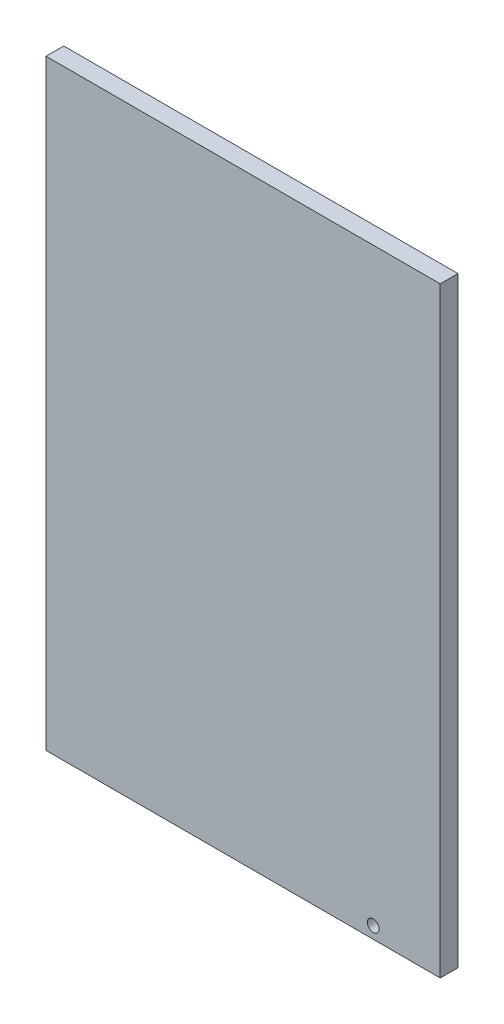
from build123d import *

# Parameters (mm, degrees)
SKETCH1_W           = 200
SKETCH1_H           = 305
BOSS_EXTRUDE1_DEPTH = 9
SKETCH2_R           = 3
CUT_EXTRUDE1_DEPTH  = 183.584911753


with BuildPart() as part:
    # Sketch1 → Boss-Extrude1 (new body)
    with BuildSketch(Plane.XY):
        Rectangle(SKETCH1_W, SKETCH1_H)
    extrude(amount=BOSS_EXTRUDE1_DEPTH)

    # Sketch2 → Cut-Extrude1 (cut, through all)
    with BuildSketch(Plane.XY.offset(9)):
        with Locations((66, -146.5)):
            Circle(SKETCH2_R)
    extrude(amount=-CUT_EXTRUDE1_DEPTH, mode=Mode.SUBTRACT)


solid = part.part
